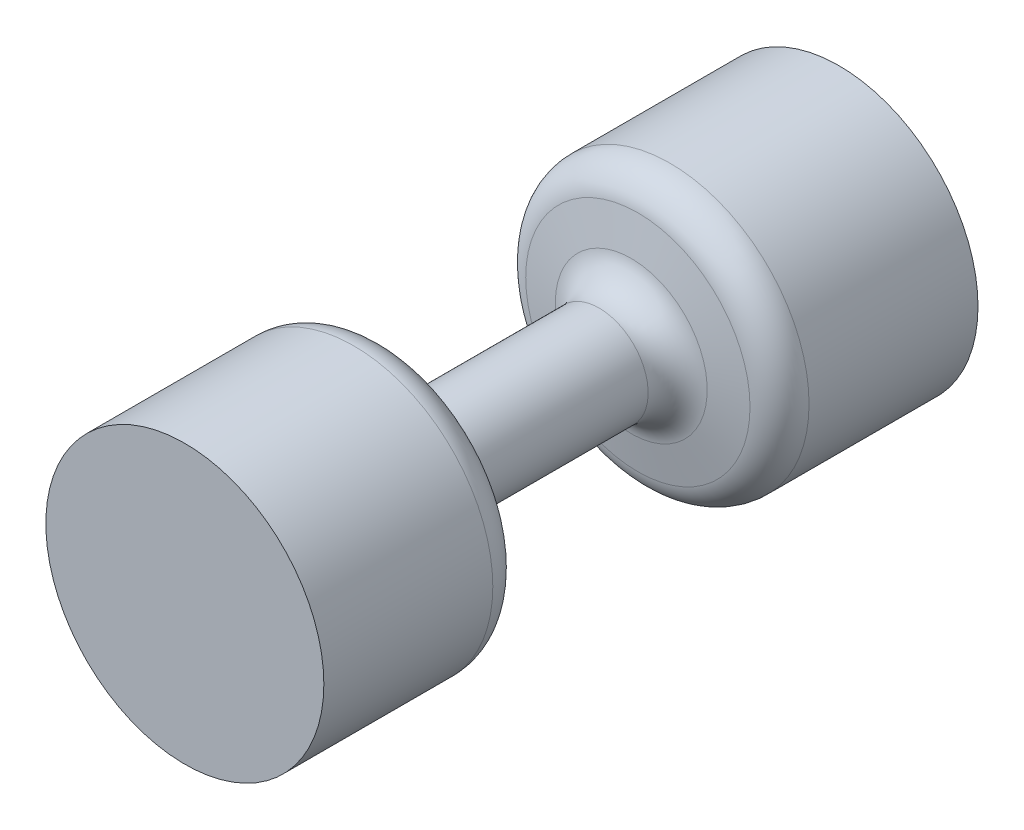
from build123d import *

# Parameters (mm, degrees)
BOSS_EXTRUDE1_DEPTH      = 20
BOSS_EXTRUDE1_DEPTH_BACK = 20
SKETCH1_R                = 8.5
FILLET1_R                = 2


# Read off the part's stored shape, not the designer's step: Shell1
with BuildPart() as part:
    # Sketch1 → Boss-Extrude1 (new, two sides: drawn at the far end of the back side and taken through both)
    with BuildSketch(Plane.XY.offset(-BOSS_EXTRUDE1_DEPTH_BACK)):
        Circle(SKETCH1_R)
    extrude(amount=BOSS_EXTRUDE1_DEPTH + BOSS_EXTRUDE1_DEPTH_BACK)

    # Sketch2 → Cut-Revolve1 (revolve, cut)
    with BuildSketch(Plane(origin=(0, 0, 0), x_dir=(0, 0, -1), z_dir=(1, 0, 0)), mode=Mode.PRIVATE) as cut_revolve1_sk:
        Polygon((-8, 8.5), (8, 8.5), (7, 3), (-7, 3), align=None)
    revolve(cut_revolve1_sk.sketch.rotate(Axis((0, 0, -22), (0, 0, 1)), 90), axis=Axis((0, 0, -22), (0, 0, 1)), mode=Mode.SUBTRACT)

    # Shell1 outline → Shell1 (revolve, cut)
    with BuildSketch(Plane.XZ):
        Polygon((1, 8.669152707), (6.5, 9.669152707), (6.5, 18), (0, 18), (0, -18), (6.5, -18), (6.5, -9.669152707), (1, -8.669152707), align=None)
    revolve(axis=Axis((0, 0, 0), (0, 0, 1)), mode=Mode.SUBTRACT)

    # Fillet1
    fillet1_edges = [part.edges().sort_by_distance(p)[0] for p in [
        (3, 0, 7),
        (0, 8.5, 8),
        (0, 8.5, -8),
        (3, 0, -7),
    ]]
    fillet(fillet1_edges, radius=FILLET1_R)


solid = part.part
